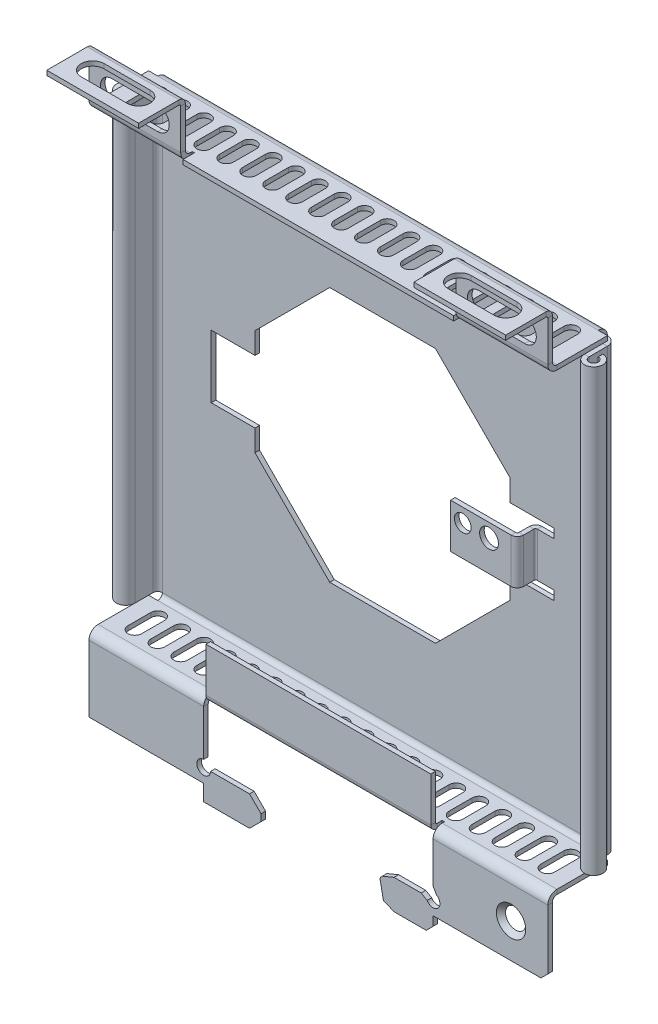
from build123d import *

# Parameters (mm, degrees)
SKETCH_1_W                         = 200
SKETCH_1_H                         = 200
SM_BASE_FLANGE_1_DEPTH             = 2
SM_EDGE_FLANGE_1_STRIP_W           = 12
SM_EDGE_FLANGE_1_STRIP_H           = 2
SM_EDGE_FLANGE_1_STRIP_CUT_DEPTH   = 200
SM_EDGE_FLANGE_1_STRIP_2_W         = 12
SM_EDGE_FLANGE_1_STRIP_2_H         = 2
SM_EDGE_FLANGE_1_STRIP_CUT_2_DEPTH = 200
SM_EDGE_FLANGE_1_DEPTH             = 200
SM_EDGE_FLANGE_1_BEND_DEPTH        = 200
SM_START                           = -101
SM_EDGE_FLANGE_3_DEPTH             = 202
SM_EDGE_FLANGE_3_2_DEPTH           = 5
SM_START_2                         = 96
SM_EDGE_FLANGE_3_3_DEPTH           = 5
SM_START_3                         = -96
SM_EDGE_FLANGE_3_4_DEPTH           = 192
SM_EDGE_FLANGE_4_STRIP_W           = 12
SM_EDGE_FLANGE_4_STRIP_H           = 2
SM_EDGE_FLANGE_4_STRIP_CUT_DEPTH   = 50
SM_EDGE_FLANGE_4_RELIEF_W          = 13
SM_EDGE_FLANGE_4_RELIEF_H          = 1
SM_EDGE_FLANGE_4_RELIEF_CUT_DEPTH  = 2
SM_EDGE_FLANGE_4_DEPTH             = 50
SM_EDGE_FLANGE_4_FLAT_DEPTH        = 2
HOLE_WIZARD_1_D                    = 3.5
HOLE_WIZARD_1_DEPTH                = 10
HOLE_WIZARD_1_CSINK_D              = 12.8
HOLE_WIZARD_1_CSINK_ANGLE          = 90
HOLE_WIZARD_1_TIP                  = 1.051506083
SM_EDGE_FLANGE_5_STRIP_W           = 12
SM_EDGE_FLANGE_5_STRIP_H           = 2
SM_EDGE_FLANGE_5_STRIP_CUT_DEPTH   = 40
SM_EDGE_FLANGE_5_RELIEF_W          = 13
SM_EDGE_FLANGE_5_RELIEF_H          = 1
SM_EDGE_FLANGE_5_RELIEF_CUT_DEPTH  = 2
SM_EDGE_FLANGE_5_DEPTH             = 40
SM_EDGE_FLANGE_5_PROFILE_W         = 40
SM_EDGE_FLANGE_5_PROFILE_H         = 38
SM_EDGE_FLANGE_5_FLAT_DEPTH        = 2
CUT_EXTRUDE_1_DEPTH                = 262.503346059
PATTERN_LINEAR_1_COUNT             = 19
PATTERN_LINEAR_1_PITCH             = 10
SKETCH_41_W                        = 149.424708154
SKETCH_41_H                        = 27.402200386
CUT_EXTRUDE_2_DEPTH                = 10
OTHER_START                        = -96
OTHER_1_DEPTH                      = 192
OTHER_1_2_DEPTH                    = 192
SM_EDGE_FLANGE_6_STRIP_W           = 9.4732
SM_EDGE_FLANGE_6_STRIP_H           = 2
SM_EDGE_FLANGE_6_STRIP_CUT_DEPTH   = 98
SM_EDGE_FLANGE_6_DEPTH             = 98
OTHER_START_2                      = 122.372677549
OTHER_1_3_OUTLINE_W                = 40
OTHER_1_3_OUTLINE_H                = 2
OTHER_1_3_DEPTH                    = 17.627322451
OTHER_START_3                      = 119.636077549
OTHER_1_3_2_OUTLINE_W              = 40
OTHER_1_3_2_OUTLINE_H              = 18.372677549
OTHER_1_3_2_DEPTH                  = 2.7366
OTHER_START_4                      = -100
OTHER_1_3_3_DEPTH                  = 200
SKETCH_50_W                        = 37.085319315
SKETCH_50_H                        = 19.402200386
SKETCH_50_R                        = 3.641647842
SKETCH_50_R_2                      = 4.105479613
SM_BASE_FLANGE_1_2_DEPTH           = 2
OTHER_START_5                      = -9.701100193
OTHER_1_4_DEPTH                    = 19.402200386
OTHER_1_4_2_DEPTH                  = 9.301883951
OTHER_START_6                      = 7.811743184
OTHER_1_4_3_DEPTH                  = 1.889357009
OTHER_START_7                      = -0.399216242
OTHER_1_4_4_DEPTH                  = 8.210959426
OTHER_START_8                      = 6
OTHER_1_4_5_OUTLINE_R              = 3.641647842
OTHER_1_4_5_OUTLINE_R_2            = 4.105479613
OTHER_1_4_5_DEPTH                  = 2
OTHER_START_9                      = 25
OTHER_1_5_DEPTH                    = 4


with BuildPart() as part:
    # Sm Base Flange 1: sheet metal written as solids
    # Sketch 1 → Sm Base Flange 1 (new body)
    with BuildSketch(Plane.XY):
        Rectangle(SKETCH_1_W, SKETCH_1_H)
    extrude(amount=-SM_BASE_FLANGE_1_DEPTH)

    # 边线-法兰1: sheet metal written as solids
    # 边线-法兰1 strip (on a plane across the edge) → 边线-法兰1 strip cut (cut)
    with BuildSketch(Plane(origin=(-100, -100, 0), x_dir=(0, 1, 0), z_dir=(1, 0, 0))):
        with Locations((-2, -1)):
            Rectangle(SM_EDGE_FLANGE_1_STRIP_W, SM_EDGE_FLANGE_1_STRIP_H)
    extrude(amount=SM_EDGE_FLANGE_1_STRIP_CUT_DEPTH, mode=Mode.SUBTRACT)

    # 边线-法兰1 strip 2 (on a plane across the edge) → 边线-法兰1 strip cut 2 (cut)
    with BuildSketch(Plane(origin=(100, 100, 0), x_dir=(0, -1, 0), z_dir=(-1, 0, 0))):
        with Locations((-2, -1)):
            Rectangle(SM_EDGE_FLANGE_1_STRIP_2_W, SM_EDGE_FLANGE_1_STRIP_2_H)
    extrude(amount=SM_EDGE_FLANGE_1_STRIP_CUT_2_DEPTH, mode=Mode.SUBTRACT)

    # 边线-法兰1 section (on a plane across the edge) → 边线-法兰1 (add)
    with BuildSketch(Plane(origin=(-100, -100, 0), x_dir=(0, 1, 0), z_dir=(1, 0, 0))):
        with BuildLine():
            Line((0, 2), (0, 28))
            Line((0, 28), (2, 28))
            Line((2, 28), (2, 2))
            ThreePointArc((2, 2), (2.585786438, 0.585786438), (4, 0))
            Line((4, 0), (4, -2))
            ThreePointArc((4, -2), (1.171572875, -0.828427125), (0, 2))
        make_face()
    extrude(amount=SM_EDGE_FLANGE_1_DEPTH)

    # 边线-法兰1 section 2 (on a plane across the edge) → 边线-法兰1 bend (add)
    with BuildSketch(Plane(origin=(100, 100, 0), x_dir=(0, -1, 0), z_dir=(-1, 0, 0))):
        with BuildLine():
            Line((0, 2), (0, 28))
            Line((0, 28), (2, 28))
            Line((2, 28), (2, 2))
            ThreePointArc((2, 2), (2.585786438, 0.585786438), (4, 0))
            Line((4, 0), (4, -2))
            ThreePointArc((4, -2), (1.171572875, -0.828427125), (0, 2))
        make_face()
    extrude(amount=SM_EDGE_FLANGE_1_BEND_DEPTH)

    # 边线-法兰3: read off the stored shape, not the designer's step
    # 边线-法兰3 outline → 边线-法兰3 (cut)
    with BuildSketch(Plane(origin=(0, 0, 0), x_dir=(1, 0, 0), z_dir=(0, 1, 0)).offset(SM_START)):
        with BuildLine():
            Line((-98, -2), (-96, -2))
            Line((-96, -2), (-96, 0))
            ThreePointArc((-96, 0), (-97.414213562, -0.585786438), (-98, -2))
        make_face()
        with BuildLine():
            ThreePointArc((-100, -2), (-98.828427125, 0.828427125), (-96, 2))
            Line((-96, 2), (-100, 2))
            Line((-100, 2), (-100, -2))
        make_face()
        with BuildLine():
            ThreePointArc((98, -2), (97.414213562, -0.585786438), (96, 0))
            Line((96, 0), (96, -2))
            Line((96, -2), (98, -2))
        make_face()
        with BuildLine():
            Line((100, 2), (96, 2))
            ThreePointArc((96, 2), (98.828427125, 0.828427125), (100, -2))
            Line((100, -2), (100, 2))
        make_face()
    extrude(amount=SM_EDGE_FLANGE_3_DEPTH, mode=Mode.SUBTRACT)

    # Sm Edge Flange 3 2 outline → Sm Edge Flange 3 2 (cut)
    with BuildSketch(Plane(origin=(0, 0, 0), x_dir=(1, 0, 0), z_dir=(0, 1, 0)).offset(SM_START)):
        with BuildLine():
            Line((-100, -2), (-98, -2))
            ThreePointArc((-98, -2), (-97.414213562, -0.585786438), (-96, 0))
            Line((-96, 0), (-96, 2))
            ThreePointArc((-96, 2), (-98.828427125, 0.828427125), (-100, -2))
        make_face()
        with BuildLine():
            ThreePointArc((100, -2), (98.828427125, 0.828427125), (96, 2))
            Line((96, 2), (96, 0))
            ThreePointArc((96, 0), (97.414213562, -0.585786438), (98, -2))
            Line((98, -2), (100, -2))
        make_face()
    extrude(amount=SM_EDGE_FLANGE_3_2_DEPTH, mode=Mode.SUBTRACT)

    # Sm Edge Flange 3 3 outline → Sm Edge Flange 3 3 (cut)
    with BuildSketch(Plane(origin=(0, 0, 0), x_dir=(1, 0, 0), z_dir=(0, 1, 0)).offset(SM_START_2)):
        with BuildLine():
            Line((-100, -2), (-98, -2))
            ThreePointArc((-98, -2), (-97.414213562, -0.585786438), (-96, 0))
            Line((-96, 0), (-96, 2))
            ThreePointArc((-96, 2), (-98.828427125, 0.828427125), (-100, -2))
        make_face()
        with BuildLine():
            ThreePointArc((100, -2), (98.828427125, 0.828427125), (96, 2))
            Line((96, 2), (96, 0))
            ThreePointArc((96, 0), (97.414213562, -0.585786438), (98, -2))
            Line((98, -2), (100, -2))
        make_face()
    extrude(amount=SM_EDGE_FLANGE_3_3_DEPTH, mode=Mode.SUBTRACT)

    # Sm Edge Flange 3 4 outline → Sm Edge Flange 3 4 (add)
    with BuildSketch(Plane(origin=(0, 0, 0), x_dir=(1, 0, 0), z_dir=(0, 1, 0)).offset(SM_START_3)):
        with BuildLine():
            Line((-98, -14), (-98, -2))
            ThreePointArc((-98, -2), (-97.414213562, -0.585786438), (-96, 0))
            Line((-96, 0), (-99.464101616, 0))
            ThreePointArc((-99.464101616, 0), (-99.863703305, -0.96472382), (-100, -2))
            Line((-100, -2), (-100, -14))
            Line((-100, -14), (-98, -14))
        make_face()
        with BuildLine():
            Line((99.464101616, 0), (96, 0))
            ThreePointArc((96, 0), (97.414213562, -0.585786438), (98, -2))
            Line((98, -2), (98, -14))
            Line((98, -14), (100, -14))
            Line((100, -14), (100, -2))
            ThreePointArc((100, -2), (99.863703305, -0.96472382), (99.464101616, 0))
        make_face()
    extrude(amount=SM_EDGE_FLANGE_3_4_DEPTH)

    # 边线-法兰4: sheet metal written as solids
    # 边线-法兰4 strip (on a plane across the edge) → 边线-法兰4 strip cut (cut)
    with BuildSketch(Plane(origin=(100, -100, 28), x_dir=(0, 0, -1), z_dir=(-1, 0, 0))):
        with Locations((-2, -1)):
            Rectangle(SM_EDGE_FLANGE_4_STRIP_W, SM_EDGE_FLANGE_4_STRIP_H)
    sm_edge_flange_4_strip_cut = extrude(amount=SM_EDGE_FLANGE_4_STRIP_CUT_DEPTH, mode=Mode.SUBTRACT)

    # 边线-法兰4 relief (on the sheet) → 边线-法兰4 relief cut (cut)
    with BuildSketch(Plane(origin=(100, -100, 24), x_dir=(0, 0, -1), z_dir=(0, -1, 0))):
        with Locations((-5.5, -50.5)):
            Rectangle(SM_EDGE_FLANGE_4_RELIEF_W, SM_EDGE_FLANGE_4_RELIEF_H)
    sm_edge_flange_4_relief_cut = extrude(amount=-SM_EDGE_FLANGE_4_RELIEF_CUT_DEPTH, mode=Mode.SUBTRACT)

    # 边线-法兰4 bend section (on a plane across the edge) → 边线-法兰4 (add)
    with BuildSketch(Plane(origin=(100, -100, 28), x_dir=(0, 0, -1), z_dir=(-1, 0, 0))):
        with BuildLine():
            Line((0, 2), (2, 2))
            ThreePointArc((2, 2), (2.585786438, 0.585786438), (4, 0))
            Line((4, 0), (4, -2))
            ThreePointArc((4, -2), (1.171572875, -0.828427125), (0, 2))
        make_face()
    sm_edge_flange_4 = extrude(amount=SM_EDGE_FLANGE_4_DEPTH)

    # 边线-法兰4 profile (on flange) → 边线-法兰4 flat (add)
    with BuildSketch(Plane(origin=(0, -100, 28), x_dir=(-1, 0, 0), z_dir=(0, 0, 1))):
        with BuildLine():
            Line((-30, 38), (-50, 38))
            Line((-50, 38), (-50, 31))
            Line((-50, 31), (-100, 31))
            Line((-100, 31), (-100, 2))
            Line((-100, 2), (-50, 2))
            Line((-50, 2), (-50, 22))
            ThreePointArc((-50, 22), (-52.121320344, 27.121320344), (-47, 25))
            Line((-47, 25), (-30, 25))
            Line((-30, 25), (-25, 30))
            Line((-25, 30), (-25, 33))
            Line((-25, 33), (-30, 38))
        make_face()
    sm_edge_flange_4_flat = extrude(amount=-SM_EDGE_FLANGE_4_FLAT_DEPTH)

    # 打孔尺寸(%根据)内六角花形半沉头螺钉的类型1
    with Locations(Plane.XY.offset(28)):
        with Locations((84, -116)):
            CounterSinkHole(HOLE_WIZARD_1_D / 2, HOLE_WIZARD_1_CSINK_D / 2, depth=HOLE_WIZARD_1_DEPTH, counter_sink_angle=HOLE_WIZARD_1_CSINK_ANGLE)
            with Locations((0, 0, -(HOLE_WIZARD_1_DEPTH + HOLE_WIZARD_1_TIP / 2))):  # 118° drill point
                Cone(0, HOLE_WIZARD_1_D / 2, HOLE_WIZARD_1_TIP, mode=Mode.SUBTRACT)

    # 边线-法兰5: sheet metal written as solids
    # 边线-法兰5 strip (on a plane across the edge) → 边线-法兰5 strip cut (cut)
    with BuildSketch(Plane(origin=(60, 100, 28), x_dir=(0, 0, -1), z_dir=(1, 0, 0))):
        with Locations((-2, -1)):
            Rectangle(SM_EDGE_FLANGE_5_STRIP_W, SM_EDGE_FLANGE_5_STRIP_H)
    sm_edge_flange_5_strip_cut = extrude(amount=SM_EDGE_FLANGE_5_STRIP_CUT_DEPTH, mode=Mode.SUBTRACT)

    # 边线-法兰5 relief (on the sheet) → 边线-法兰5 relief cut (cut)
    with BuildSketch(Plane(origin=(60, 100, 24), x_dir=(0, 0, -1), z_dir=(0, 1, 0))):
        with Locations((-5.5, 0.5)):
            Rectangle(SM_EDGE_FLANGE_5_RELIEF_W, SM_EDGE_FLANGE_5_RELIEF_H)
    sm_edge_flange_5_relief_cut = extrude(amount=-SM_EDGE_FLANGE_5_RELIEF_CUT_DEPTH, mode=Mode.SUBTRACT)

    # 边线-法兰5 bend section (on a plane across the edge) → 边线-法兰5 (add)
    with BuildSketch(Plane(origin=(60, 100, 28), x_dir=(0, 0, -1), z_dir=(1, 0, 0))):
        with BuildLine():
            Line((0, 2), (2, 2))
            ThreePointArc((2, 2), (2.585786438, 0.585786438), (4, 0))
            Line((4, 0), (4, -2))
            ThreePointArc((4, -2), (1.171572875, -0.828427125), (0, 2))
        make_face()
    sm_edge_flange_5 = extrude(amount=SM_EDGE_FLANGE_5_DEPTH)

    # 边线-法兰5 profile (on flange) → 边线-法兰5 flat (add)
    with BuildSketch(Plane(origin=(0, 100, 28), x_dir=(1, 0, 0), z_dir=(0, 0, 1))):
        with Locations((80, 21)):
            Rectangle(SM_EDGE_FLANGE_5_PROFILE_W, SM_EDGE_FLANGE_5_PROFILE_H)
        with BuildLine():
            ThreePointArc((70, 5), (65, 10), (70, 15))
            Line((70, 15), (90, 15))
            ThreePointArc((90, 15), (95, 10), (90, 5))
            Line((90, 5), (70, 5))
        make_face(mode=Mode.SUBTRACT)
        with BuildLine():
            Line((70, 35), (90, 35))
            ThreePointArc((90, 35), (95, 30), (90, 25))
            Line((90, 25), (70, 25))
            ThreePointArc((70, 25), (65, 30), (70, 35))
        make_face(mode=Mode.SUBTRACT)
    sm_edge_flange_5_flat = extrude(amount=-SM_EDGE_FLANGE_5_FLAT_DEPTH)

    # 镜向1: 边线-法兰4 strip cut, 边线-法兰4 relief cut, 边线-法兰4, 边线-法兰4 flat, 边线-法兰5 strip cut, 边线-法兰5 relief cut, 边线-法兰5, 边线-法兰5 flat across plane
    add(sm_edge_flange_4_strip_cut.mirror(Plane(origin=(0, 0, 0), x_dir=(0, 0, 1), z_dir=(1, 0, 0))), mode=Mode.SUBTRACT)
    add(sm_edge_flange_4_relief_cut.mirror(Plane(origin=(0, 0, 0), x_dir=(0, 0, 1), z_dir=(1, 0, 0))), mode=Mode.SUBTRACT)
    add(sm_edge_flange_4.mirror(Plane(origin=(0, 0, 0), x_dir=(0, 0, 1), z_dir=(1, 0, 0))))
    add(sm_edge_flange_4_flat.mirror(Plane(origin=(0, 0, 0), x_dir=(0, 0, 1), z_dir=(1, 0, 0))))
    add(sm_edge_flange_5_strip_cut.mirror(Plane(origin=(0, 0, 0), x_dir=(0, 0, 1), z_dir=(1, 0, 0))), mode=Mode.SUBTRACT)
    add(sm_edge_flange_5_relief_cut.mirror(Plane(origin=(0, 0, 0), x_dir=(0, 0, 1), z_dir=(1, 0, 0))), mode=Mode.SUBTRACT)
    add(sm_edge_flange_5.mirror(Plane(origin=(0, 0, 0), x_dir=(0, 0, 1), z_dir=(1, 0, 0))))
    add(sm_edge_flange_5_flat.mirror(Plane(origin=(0, 0, 0), x_dir=(0, 0, 1), z_dir=(1, 0, 0))))

    # 草图40 → 切除-拉伸1 (cut, through all)
    with BuildSketch(Plane.XZ.offset(100)):
        with BuildLine():
            Line((-87, 18), (-87, 8))
            ThreePointArc((-87, 8), (-90, 5), (-93, 8))
            Line((-93, 8), (-93, 18))
            ThreePointArc((-93, 18), (-90, 21), (-87, 18))
        make_face()
    cut_extrude_1 = extrude(amount=-CUT_EXTRUDE_1_DEPTH, mode=Mode.SUBTRACT)

    # 阵列(线性)1: 切除-拉伸1 ×19
    with Locations(*[(i * PATTERN_LINEAR_1_PITCH, 0, 0) for i in range(1, PATTERN_LINEAR_1_COUNT)]):
        add(cut_extrude_1, mode=Mode.SUBTRACT)

    # 草图41 → 切除-拉伸2 (cut)
    with BuildSketch(Plane.XY):
        Polygon((23.043458094, -55.631829055), (55.631829055, -23.043458094), (55.631829055, 23.043458094), (23.043458094, 55.631829055), (-23.043458094, 55.631829055), (-55.631829055, 23.043458094), (-55.631829055, -23.043458094), (-23.043458094, -55.631829055), align=None)
        Rectangle(SKETCH_41_W, SKETCH_41_H)
    extrude(amount=-CUT_EXTRUDE_2_DEPTH, mode=Mode.SUBTRACT)

    # Other 1: read off the stored shape, not the designer's step
    # Other 1 outline → Other 1 (cut)
    with BuildSketch(Plane(origin=(0, 0, 0), x_dir=(1, 0, 0), z_dir=(0, 1, 0)).offset(OTHER_START)):
        with BuildLine():
            ThreePointArc((-98, -10), (-98.535898385, -12), (-100, -13.464101615))
            Line((-100, -13.464101615), (-100, -14))
            Line((-100, -14), (-98, -14))
            Line((-98, -14), (-98, -10))
        make_face()
        with BuildLine():
            Line((100, -14), (100, -13.464101615))
            ThreePointArc((100, -13.464101615), (98.535898385, -12), (98, -10))
            Line((98, -10), (98, -14))
            Line((98, -14), (100, -14))
        make_face()
    extrude(amount=OTHER_1_DEPTH, mode=Mode.SUBTRACT)

    # Other 1 2 outline → Other 1 2 (add)
    with BuildSketch(Plane(origin=(0, 0, 0), x_dir=(1, 0, 0), z_dir=(0, 1, 0)).offset(OTHER_START)):
        with BuildLine():
            Line((-102, -8), (-102, -6))
            ThreePointArc((-102, -6), (-105.863703305, -11.035276181), (-100, -13.464101615))
            Line((-100, -13.464101615), (-100, -10))
            ThreePointArc((-100, -10), (-103.414213562, -11.414213562), (-102, -8))
        make_face()
        with BuildLine():
            Line((102, -6), (102, -8))
            ThreePointArc((102, -8), (103.414213562, -11.414213562), (100, -10))
            Line((100, -10), (100, -13.464101615))
            ThreePointArc((100, -13.464101615), (105.863703305, -11.035276181), (102, -6))
        make_face()
    extrude(amount=OTHER_1_2_DEPTH)

    # 边线-法兰6: sheet metal written as solids
    # 边线-法兰6 strip (on a plane across the edge) → 边线-法兰6 strip cut (cut)
    with BuildSketch(Plane(origin=(-49, -98, 28), x_dir=(0, 0, -1), z_dir=(1, 0, 0))):
        with Locations((-2, -1)):
            Rectangle(SM_EDGE_FLANGE_6_STRIP_W, SM_EDGE_FLANGE_6_STRIP_H)
    extrude(amount=SM_EDGE_FLANGE_6_STRIP_CUT_DEPTH, mode=Mode.SUBTRACT)

    # 边线-法兰6 section (on a plane across the edge) → 边线-法兰6 (add)
    with BuildSketch(Plane(origin=(-49, -98, 28), x_dir=(0, 0, -1), z_dir=(1, 0, 0))):
        with BuildLine():
            Line((0, 0.7366), (0, 20))
            Line((0, 20), (2, 20))
            Line((2, 20), (2, 0.7366))
            ThreePointArc((2, 0.7366), (2.215745145, 0.215745145), (2.7366, 0))
            Line((2.7366, 0), (2.7366, -2))
            ThreePointArc((2.7366, -2), (0.801531583, -1.198468417), (0, 0.7366))
        make_face()
    extrude(amount=SM_EDGE_FLANGE_6_DEPTH)

    # Other 1 3: read off the stored shape, not the designer's step
    # Other 1 3 outline → Other 1 3 (cut)
    with BuildSketch(Plane(origin=(0, 0, 0), x_dir=(1, 0, 0), z_dir=(0, 1, 0)).offset(OTHER_START_2)):
        with Locations((-80, -27)):
            Rectangle(OTHER_1_3_OUTLINE_W, OTHER_1_3_OUTLINE_H)
        with Locations((80, -27)):
            Rectangle(OTHER_1_3_OUTLINE_W, OTHER_1_3_OUTLINE_H)
    extrude(amount=OTHER_1_3_DEPTH, mode=Mode.SUBTRACT)

    # Other 1 3 2 outline → Other 1 3 2 (add)
    # profile 1 of 2: a face of its own
    with BuildSketch(Plane(origin=(0, 0, 0), x_dir=(1, 0, 0), z_dir=(0, 1, 0)).offset(OTHER_START_3)):
        with Locations((-80, -37.186338775)):
            Rectangle(OTHER_1_3_2_OUTLINE_W, OTHER_1_3_2_OUTLINE_H)
        with BuildLine():
            Line((-90, -31.372677549), (-70, -31.372677549))
            ThreePointArc((-70, -31.372677549), (-65, -36.372677549), (-70, -41.372677549))
            Line((-70, -41.372677549), (-90, -41.372677549))
            ThreePointArc((-90, -41.372677549), (-95, -36.372677549), (-90, -31.372677549))
        make_face(mode=Mode.SUBTRACT)
    # profile 2 of 2: a face of its own
    with BuildSketch(Plane(origin=(0, 0, 0), x_dir=(1, 0, 0), z_dir=(0, 1, 0)).offset(OTHER_START_3)):
        with Locations((80, -37.186338775)):
            Rectangle(OTHER_1_3_2_OUTLINE_W, OTHER_1_3_2_OUTLINE_H)
        with BuildLine():
            ThreePointArc((70, -41.372677549), (65, -36.372677549), (70, -31.372677549))
            Line((70, -31.372677549), (90, -31.372677549))
            ThreePointArc((90, -31.372677549), (95, -36.372677549), (90, -41.372677549))
            Line((90, -41.372677549), (70, -41.372677549))
        make_face(mode=Mode.SUBTRACT)
    extrude(amount=OTHER_1_3_2_DEPTH)

    # Other 1 3 3 outline → Other 1 3 3 (cut)
    with BuildSketch(Plane.YZ.offset(OTHER_START_4)):
        with BuildLine():
            ThreePointArc((122.372677549, 28.7366), (121.571145966, 26.801531582), (119.636077549, 26))
            Line((119.636077549, 26), (122.372677549, 26))
            Line((122.372677549, 26), (122.372677549, 28.7366))
        make_face()
        with BuildLine():
            ThreePointArc((119.636077549, 28), (120.156932404, 28.215745145), (120.372677549, 28.7366))
            Line((120.372677549, 28.7366), (120.372677549, 46.372677549))
            Line((120.372677549, 46.372677549), (119.636077549, 46.372677549))
            Line((119.636077549, 46.372677549), (119.636077549, 28))
        make_face()
    extrude(amount=OTHER_1_3_3_DEPTH, mode=Mode.SUBTRACT)

    # Sm Base Flange 1 2: sheet metal written as solids
    # 草图50 → Sm Base Flange 1 2 (add)
    with BuildSketch(Plane.XY):
        with Locations((56.16969442, 0)):
            Rectangle(SKETCH_50_W, SKETCH_50_H)
        with Locations((42.940469932, 3.706263471)):
            Circle(SKETCH_50_R, mode=Mode.SUBTRACT)
        with Locations((54.397564517, 3.706263471)):
            Circle(SKETCH_50_R_2, mode=Mode.SUBTRACT)
    extrude(amount=-SM_BASE_FLANGE_1_2_DEPTH)

    # Other 1 4: read off the stored shape, not the designer's step
    # Other 1 4 outline → Other 1 4 (cut)
    with BuildSketch(Plane(origin=(0, 0, 0), x_dir=(1, 0, 0), z_dir=(0, 1, 0)).offset(OTHER_START_5)):
        with BuildLine():
            ThreePointArc((64.813351679, 0), (65.794686868, 1.443395312), (67.448954077, 2))
            Line((67.448954077, 2), (37.627034762, 2))
            Line((37.627034762, 2), (37.627034762, 0))
            Line((37.627034762, 0), (64.813351679, 0))
        make_face()
    extrude(amount=OTHER_1_4_DEPTH, mode=Mode.SUBTRACT)

    # Other 1 4 2 outline → Other 1 4 2 (add)
    with BuildSketch(Plane(origin=(0, 0, 0), x_dir=(1, 0, 0), z_dir=(0, 1, 0)).offset(OTHER_START_5)):
        with BuildLine():
            Line((67.448954077, 0), (64.813351679, 0))
            ThreePointArc((64.813351679, 0), (64.737721048, -0.364854094), (64.712354077, -0.7366))
            Line((64.712354077, -0.7366), (64.712354077, -5.2634))
            ThreePointArc((64.712354077, -5.2634), (64.496608932, -5.784254855), (63.975754077, -6))
            Line((63.975754077, -6), (37.627034762, -6))
            Line((37.627034762, -6), (37.627034762, -8))
            Line((37.627034762, -8), (63.975754077, -8))
            ThreePointArc((63.975754077, -8), (65.910822494, -7.198468418), (66.712354077, -5.2634))
            Line((66.712354077, -5.2634), (66.712354077, -0.7366))
            ThreePointArc((66.712354077, -0.7366), (66.928099222, -0.215745145), (67.448954077, 0))
        make_face()
    extrude(amount=OTHER_1_4_2_DEPTH)

    # Other 1 4 3 outline → Other 1 4 3 (add)
    with BuildSketch(Plane(origin=(0, 0, 0), x_dir=(1, 0, 0), z_dir=(0, 1, 0)).offset(OTHER_START_6)):
        with BuildLine():
            Line((67.448954077, 0), (64.813351679, 0))
            ThreePointArc((64.813351679, 0), (64.737721048, -0.364854094), (64.712354077, -0.7366))
            Line((64.712354077, -0.7366), (64.712354077, -5.2634))
            ThreePointArc((64.712354077, -5.2634), (64.496608932, -5.784254855), (63.975754077, -6))
            Line((63.975754077, -6), (37.627034762, -6))
            Line((37.627034762, -6), (37.627034762, -8))
            Line((37.627034762, -8), (63.975754077, -8))
            ThreePointArc((63.975754077, -8), (65.910822494, -7.198468418), (66.712354077, -5.2634))
            Line((66.712354077, -5.2634), (66.712354077, -0.7366))
            ThreePointArc((66.712354077, -0.7366), (66.928099222, -0.215745145), (67.448954077, 0))
        make_face()
    extrude(amount=OTHER_1_4_3_DEPTH)

    # Other 1 4 4 outline → Other 1 4 4 (add)
    with BuildSketch(Plane(origin=(0, 0, 0), x_dir=(1, 0, 0), z_dir=(0, 1, 0)).offset(OTHER_START_7)):
        with BuildLine():
            Line((67.448954077, 0), (64.813351679, 0))
            ThreePointArc((64.813351679, 0), (64.737721048, -0.364854094), (64.712354077, -0.7366))
            Line((64.712354077, -0.7366), (64.712354077, -5.2634))
            ThreePointArc((64.712354077, -5.2634), (64.496608932, -5.784254855), (63.975754077, -6))
            Line((63.975754077, -6), (37.627034762, -6))
            Line((37.627034762, -6), (37.627034762, -8))
            Line((37.627034762, -8), (63.975754077, -8))
            ThreePointArc((63.975754077, -8), (65.910822494, -7.198468418), (66.712354077, -5.2634))
            Line((66.712354077, -5.2634), (66.712354077, -0.7366))
            ThreePointArc((66.712354077, -0.7366), (66.928099222, -0.215745145), (67.448954077, 0))
        make_face()
    extrude(amount=OTHER_1_4_4_DEPTH)

    # Other 1 4 5 outline → Other 1 4 5 (cut)
    with BuildSketch(Plane.XY.offset(OTHER_START_8)):
        with Locations((42.940469932, 3.706263471)):
            Circle(OTHER_1_4_5_OUTLINE_R)
        with Locations((54.397564517, 3.706263471)):
            Circle(OTHER_1_4_5_OUTLINE_R_2)
    extrude(amount=OTHER_1_4_5_DEPTH, mode=Mode.SUBTRACT)

    # Other 1 5: read off the stored shape, not the designer's step
    # Other 1 5 outline → Other 1 5 (cut)
    with BuildSketch(Plane.XY.offset(OTHER_START_9)):
        Polygon((100, -131), (100, -128), (97, -131), align=None)
        with BuildLine():
            ThreePointArc((50, -122), (50.776457135, -122.102222521), (51.5, -122.401923789))
            Line((51.5, -122.401923789), (50, -119.803847577))
            Line((50, -119.803847577), (50, -122))
        make_face()
        with BuildLine():
            Line((47, -125), (44.803847577, -125))
            Line((44.803847577, -125), (47.401923789, -126.5))
            ThreePointArc((47.401923789, -126.5), (47.102222521, -125.776457135), (47, -125))
        make_face()
        Polygon((30, -125), (27.878679656, -127.121320344), (33, -125), align=None)
        Polygon((30, -138), (33, -138), (28.352970135, -136.075137205), (26.851949703, -128.52899791), (27.121320344, -127.878679656), (25, -130), (25, -133), align=None)
        Polygon((50, -138), (50, -135), (47, -138), align=None)
    extrude(amount=OTHER_1_5_DEPTH, mode=Mode.SUBTRACT)


solid = part.part
